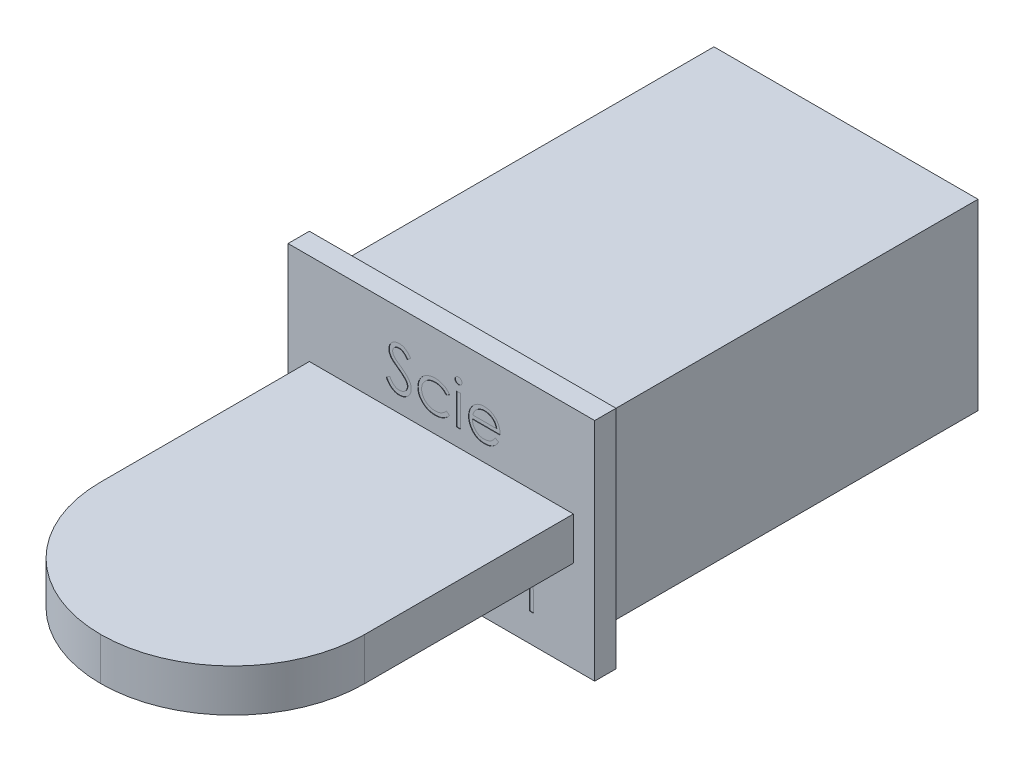
from build123d import *

# Parameters (mm, degrees)
ESQUISSE1_W             = 720
ESQUISSE1_H             = 530
BOSS_EXTRU_1_DEPTH      = 50
ESQUISSE2_W             = 620
ESQUISSE2_H             = 430
BOSS_EXTRU_2_DEPTH      = 900
ESQUISSE3_W             = 620
ESQUISSE3_H             = 100
BOSS_EXTRU_3_DEPTH      = 800
CONG_1_R                = 310
ESQUISSE4_W             = 8.974358974
ESQUISSE4_H             = 73.076923077
ENL_V_MAT_EXTRU_1_DEPTH = 1


with BuildPart() as part:
    # Esquisse1 → Boss.-Extru.1 (new body)
    with BuildSketch(Plane.XY):
        with Locations((360, 265)):
            Rectangle(ESQUISSE1_W, ESQUISSE1_H)
    extrude(amount=BOSS_EXTRU_1_DEPTH)

    # Esquisse2 → Boss.-Extru.2 (add)
    with BuildSketch(Plane(origin=(0, 0, 0), x_dir=(-1, 0, 0), z_dir=(0, 0, -1))):
        with Locations((-360, 265)):
            Rectangle(ESQUISSE2_W, ESQUISSE2_H)
    extrude(amount=BOSS_EXTRU_2_DEPTH)

    # Esquisse3 → Boss.-Extru.3 (add)
    with BuildSketch(Plane.XY.offset(50)):
        with Locations((360, 265)):
            Rectangle(ESQUISSE3_W, ESQUISSE3_H)
    extrude(amount=BOSS_EXTRU_3_DEPTH)

    # Congé1
    cong_1_edges = [part.edges().sort_by_distance(p)[0] for p in [
        (670, 265, 850),
        (50, 265, 850),
    ]]
    fillet(cong_1_edges, radius=CONG_1_R - 0.0001)  # a hair under: the kernel refuses the full size

    # Esquisse4 → Enlèv. mat.-Extru.1 (cut)
    # profile 1 of 10: a face of its own
    with BuildSketch(Plane.XY.offset(50)):
        with BuildLine():
            Line((230.237927388, 373.871225546), (238.691453029, 378.93933452))
            add(Edge.make_bspline(
                [(238.691453029, 378.93933452), (239.477688379, 377.623209236), (240.984084969, 375.101563981), (243.496980945, 371.694191398), (246.100778406, 368.798129776), (248.814759365, 366.430226703), (251.622357883, 364.565972796), (254.541902275, 363.245909033), (257.56355401, 362.422595451), (259.619948909, 362.322592978), (260.646581234, 362.272667853)],
                knots=[0, 0, 0, 0, 1.272034388, 2.437168799, 3.508375237, 4.49857839, 5.41946034, 6.295179144, 7.148887113, 8, 8, 8, 8], degree=3))
            add(Edge.make_bspline(
                [(260.646581234, 362.272667853), (261.523348678, 362.297087068), (263.261542193, 362.345498218), (265.820463421, 362.810663991), (268.305657771, 363.525296246), (270.665904563, 364.548751432), (272.868636407, 365.786993881), (274.800256274, 367.282598953), (276.470145222, 368.957061973), (277.836119924, 370.82513782), (278.884120932, 372.834199209), (279.689608601, 374.896369247), (280.136610706, 377.044042627), (280.203946519, 378.490055851), (280.237927388, 379.219783238)],
                knots=[0, 0, 0, 0, 1.095163259, 2.171163733, 3.241058638, 4.321873601, 5.38011039, 6.391990106, 7.366004449, 8.327778327, 9.272591725, 10.192022065, 11.087607919, 12, 12, 12, 12], degree=3))
            add(Edge.make_bspline(
                [(280.237927388, 379.219783238), (280.195804225, 380.052378944), (280.110173991, 381.744924348), (279.386417417, 384.24205729), (278.247867507, 386.713273576), (277.197506259, 388.241881164), (276.652190209, 389.035488366)],
                knots=[0, 0, 0, 0, 0.938893495, 1.908633276, 2.914225137, 4, 4, 4, 4], degree=3))
            add(Edge.make_bspline(
                [(276.652190209, 389.035488366), (276.204458375, 389.608254755), (275.264501395, 390.810706143), (273.648572464, 392.600570013), (271.75239777, 394.446810555), (269.640867629, 396.419926468), (267.237065091, 398.42814923), (264.616278965, 400.567242886), (261.711597281, 402.755859373), (259.674468806, 404.22364696), (258.623344055, 404.981001187)],
                knots=[0, 0, 0, 0, 0.722233717, 1.516239348, 2.393582979, 3.351407094, 4.387010283, 5.505090956, 6.712668013, 8, 8, 8, 8], degree=3))
            add(Edge.make_bspline(
                [(258.623344055, 404.981001187), (257.571229878, 405.730389404), (255.55966769, 407.163162611), (252.746565338, 409.289570726), (250.231009252, 411.233681284), (248.024180208, 413.013795916), (246.12704887, 414.630156051), (244.524665698, 416.067240027), (243.257849781, 417.363913194), (242.553404619, 418.205094387), (242.237126106, 418.582764007)],
                knots=[0, 0, 0, 0, 1.452282411, 2.77665338, 3.964542531, 5.026858415, 5.96415736, 6.766646006, 7.446254459, 8, 8, 8, 8], degree=3))
            add(Edge.make_bspline(
                [(242.237126106, 418.582764007), (241.795053385, 419.17136506), (240.925658051, 420.328928025), (239.778057894, 422.138209676), (238.802653243, 423.990302973), (238.038015182, 425.890184818), (237.394123215, 427.811182786), (236.96103948, 429.778361234), (236.689856711, 431.78289319), (236.662085668, 433.131850351), (236.648183799, 433.807122982)],
                knots=[0, 0, 0, 0, 1.068054152, 2.10047183, 3.106115577, 4.101338837, 5.06977816, 6.043150881, 7.020423561, 8, 8, 8, 8], degree=3))
            add(Edge.make_bspline(
                [(236.648183799, 433.807122982), (236.685475484, 434.865116541), (236.759261772, 436.95848979), (237.383276551, 440.016513517), (238.368216369, 442.936125438), (239.748070308, 445.688420687), (241.52685182, 448.201734427), (243.585308231, 450.504976912), (246.03706498, 452.441222118), (248.727139931, 454.132995215), (251.671607705, 455.457164507), (254.757062087, 456.456049654), (257.988407002, 457.022028445), (260.177067992, 457.1032503), (261.287606875, 457.144462725)],
                knots=[0, 0, 0, 0, 1.005424448, 1.989358655, 2.955360095, 3.929531133, 4.905563448, 5.876582895, 6.856512386, 7.866279853, 8.892233794, 9.918561126, 10.94386622, 12, 12, 12, 12], degree=3))
            add(Edge.make_bspline(
                [(261.287606875, 457.144462725), (262.466009741, 457.103818394), (264.809476934, 457.022989791), (268.256597379, 456.320203182), (271.57547499, 455.157326845), (274.245282556, 453.837650903), (276.334790027, 452.519610454), (277.928296675, 451.319044046), (279.543080983, 449.936898086), (281.192168264, 448.369491055), (282.847615677, 446.602441024), (284.534000026, 444.647849912), (286.25526485, 442.517662602), (287.362575139, 440.99696258), (287.930235081, 440.217379392)],
                knots=[0, 0, 0, 0, 1.286793592, 2.559021753, 3.825965368, 5.121522368, 5.803751409, 6.523245864, 7.299691795, 8.125521123, 9.008227632, 9.944561021, 10.946284179, 12, 12, 12, 12], degree=3))
            Line((287.930235081, 440.217379392), (279.817254311, 434.067539648))
            add(Edge.make_bspline(
                [(279.817254311, 434.067539648), (279.327370526, 434.698645089), (278.383968896, 435.91400661), (276.951697843, 437.616044198), (275.601736474, 439.170800756), (274.271725051, 440.521232986), (273.031907009, 441.741293938), (271.828562945, 442.785858419), (270.679010053, 443.665161146), (269.229955463, 444.603548573), (267.409449225, 445.533734389), (265.124176761, 446.320850905), (262.735997474, 446.793852675), (261.109436574, 446.856392319), (260.286004311, 446.888052469)],
                knots=[0, 0, 0, 0, 1.181633172, 2.275549214, 3.290209073, 4.226197932, 5.078386478, 5.862611352, 6.581680152, 7.217281963, 8.414376989, 9.595101626, 10.782541182, 12, 12, 12, 12], degree=3))
            add(Edge.make_bspline(
                [(260.286004311, 446.888052469), (259.252960814, 446.85343247), (257.260833745, 446.786671064), (254.432541285, 446.057528627), (251.887000569, 444.909475476), (249.699784424, 443.300476102), (247.878727937, 441.394162025), (246.561429116, 439.200480451), (245.768567271, 436.778126091), (245.671816424, 435.088364482), (245.622542773, 434.227796059)],
                knots=[0, 0, 0, 0, 1.14458467, 2.207223713, 3.21896685, 4.227309161, 5.202851033, 6.127160689, 7.046193047, 8, 8, 8, 8], degree=3))
            add(Edge.make_bspline(
                [(245.622542773, 434.227796059), (245.633774962, 433.692039529), (245.656257708, 432.619650402), (245.969823357, 431.035324061), (246.372661327, 429.455000077), (247.011022234, 427.885783425), (247.892316623, 426.300230309), (249.049607363, 424.671037807), (250.507130565, 422.983846131), (251.623616632, 421.886492595), (252.213087645, 421.307122982)],
                knots=[0, 0, 0, 0, 0.858281714, 1.717966888, 2.583508476, 3.4729293, 4.427298488, 5.488583878, 6.674047936, 8, 8, 8, 8], degree=3))
            add(Edge.make_bspline(
                [(252.213087645, 421.307122982), (252.431983999, 421.111779387), (252.952031632, 420.64768772), (253.902772367, 419.887908273), (255.158280888, 418.950686208), (256.68577235, 417.791048594), (258.513411257, 416.445863962), (260.641398575, 414.932332186), (263.046013799, 413.201319072), (264.752354253, 411.991103626), (265.654594055, 411.351193494)],
                knots=[0, 0, 0, 0, 0.420754252, 0.999615792, 1.744751191, 2.668019286, 3.750313428, 4.999500688, 6.413464383, 8, 8, 8, 8], degree=3))
            add(Edge.make_bspline(
                [(265.654594055, 411.351193494), (266.739905864, 410.561440364), (268.84146176, 409.032192886), (271.831678329, 406.734602028), (274.542929989, 404.487522926), (276.984735805, 402.30530558), (279.181218904, 400.204502923), (281.108010923, 398.159840628), (282.784744647, 396.185967123), (284.589865175, 393.655322103), (286.434374304, 390.547291124), (288.018417373, 386.739341451), (289.0172273, 382.916589437), (289.147842027, 380.347251252), (289.212286363, 379.079558879)],
                knots=[0, 0, 0, 0, 1.163667725, 2.253281268, 3.268753668, 4.215851969, 5.092017293, 5.902905408, 6.650798638, 7.335211899, 8.59617414, 9.77448103, 10.901945474, 12, 12, 12, 12], degree=3))
            add(Edge.make_bspline(
                [(289.212286363, 379.079558879), (289.193510988, 378.183034162), (289.156324843, 376.407394632), (288.728870163, 373.800106721), (288.102594016, 371.267796159), (287.158673046, 368.841764375), (286.00658281, 366.477628298), (284.544690014, 364.237402572), (282.850184736, 362.07150547), (280.906362881, 360.037691431), (278.779337101, 358.17065726), (276.531231539, 356.509826932), (274.158366598, 355.125017692), (271.673614693, 353.994993634), (269.076405072, 353.111178847), (266.367611249, 352.470811158), (263.542768071, 352.077790846), (261.622754312, 352.036997661), (260.646581234, 352.016257597)],
                knots=[0, 0, 0, 0, 0.983748083, 1.948392443, 2.894712957, 3.844097841, 4.80183111, 5.778335162, 6.776009319, 7.81870978, 8.863265674, 9.881300176, 10.883814829, 11.87499822, 12.874611388, 13.892143829, 14.928324115, 16, 16, 16, 16], degree=3))
            add(Edge.make_bspline(
                [(260.646581234, 352.016257597), (259.891285721, 352.030862786), (258.390206862, 352.059889225), (256.169935951, 352.316497237), (253.994519117, 352.67955734), (251.891253916, 353.255959339), (249.833042155, 353.95530154), (247.828835454, 354.816396758), (245.877662487, 355.848316799), (243.968588691, 357.028174645), (242.106469417, 358.401253062), (240.308770333, 360.000495817), (238.51650789, 361.78179596), (236.782582281, 363.793526341), (235.071921015, 366.003185851), (233.418252171, 368.431448234), (231.787345951, 371.065086913), (230.764046871, 372.918375077), (230.237927388, 373.871225546)],
                knots=[0, 0, 0, 0, 0.915332311, 1.819136955, 2.706846663, 3.586547465, 4.459518054, 5.340707479, 6.227863349, 7.133153174, 8.059268498, 9.028702269, 10.047606654, 11.120612155, 12.245963614, 13.433783089, 14.680604001, 16, 16, 16, 16], degree=3))
        make_face()
    # profile 2 of 10: a face of its own
    with BuildSketch(Plane.XY.offset(50)):
        with BuildLine():
            Line((378.955876106, 411.811930674), (371.443856875, 407.144462725))
            add(Edge.make_bspline(
                [(371.443856875, 407.144462725), (370.620146436, 408.168131121), (368.998812286, 410.183048558), (366.183405534, 412.783332366), (363.183079413, 415.016676416), (359.946563764, 416.836783586), (356.478398048, 418.24311074), (352.792259441, 419.238259468), (348.888673587, 419.858380692), (346.212525043, 419.928861745), (344.841292773, 419.964975546)],
                knots=[0, 0, 0, 0, 1.026593902, 2.0206758, 2.988051866, 3.946915611, 4.916868779, 5.907761954, 6.927957743, 8, 8, 8, 8], degree=3))
            add(Edge.make_bspline(
                [(344.841292773, 419.964975546), (343.745322575, 419.934780054), (341.586839072, 419.875310854), (338.41809183, 419.503582473), (335.399738884, 418.828096521), (332.512861486, 417.938069187), (329.777992385, 416.74520376), (327.187966144, 415.293496442), (324.719809287, 413.606352434), (322.445045249, 411.651765422), (320.364216475, 409.526089204), (318.561390359, 407.247412193), (316.991763697, 404.88398673), (315.760164944, 402.376794095), (314.752302931, 399.783192574), (314.089253782, 397.054225269), (313.647405342, 394.224853624), (313.596853096, 392.295758203), (313.571260722, 391.319142212)],
                knots=[0, 0, 0, 0, 1.112346261, 2.190735716, 3.231507886, 4.247384806, 5.251966152, 6.253067467, 7.256802811, 8.280671706, 9.291813951, 10.270744147, 11.225547591, 12.165006084, 13.100104208, 14.043489273, 15.009504848, 16, 16, 16, 16], degree=3))
            add(Edge.make_bspline(
                [(313.571260722, 391.319142212), (313.622096499, 390.040021897), (313.723083086, 387.499016303), (314.514553363, 383.748213395), (315.810107858, 380.121822242), (317.583189305, 376.645589753), (319.825393146, 373.428613888), (322.458894954, 370.543372334), (325.485154476, 368.045771528), (328.877506783, 365.975127954), (332.556299453, 364.310517451), (336.481731017, 363.124593654), (340.621724744, 362.408811581), (343.456203233, 362.31864178), (344.901388927, 362.272667853)],
                knots=[0, 0, 0, 0, 0.966302908, 1.919585723, 2.883856336, 3.870342332, 4.860282998, 5.839159637, 6.814385684, 7.815993281, 8.834850808, 9.858348828, 10.908058873, 12, 12, 12, 12], degree=3))
            add(Edge.make_bspline(
                [(344.901388927, 362.272667853), (346.225822766, 362.309796345), (348.828686721, 362.382763683), (352.633466294, 362.997876921), (356.255749461, 364.004837881), (359.695407478, 365.409056454), (362.946155079, 367.224128337), (365.986988649, 369.462961789), (368.878415457, 372.061150369), (370.578329073, 374.070235263), (371.443856875, 375.093180674)],
                knots=[0, 0, 0, 0, 1.039848629, 2.043578496, 3.018386758, 3.987534228, 4.954977003, 5.934852016, 6.948509513, 8, 8, 8, 8], degree=3))
            Line((371.443856875, 375.093180674), (378.955876106, 370.165296059))
            add(Edge.make_bspline(
                [(378.955876106, 370.165296059), (378.510513186, 369.51127529), (377.62126556, 368.205404529), (376.134761976, 366.364144053), (374.531338213, 364.640667415), (372.817249731, 363.03728484), (371.014878021, 361.515627148), (369.062652033, 360.148439305), (367.023520277, 358.858872942), (364.873544342, 357.698505165), (362.63495297, 356.655467406), (360.310896124, 355.758576814), (357.911472903, 354.98800236), (355.433862155, 354.375506738), (352.873179347, 353.886625638), (350.236046934, 353.562234165), (347.523373174, 353.320083276), (345.689883137, 353.305629936), (344.761164568, 353.298308879)],
                knots=[0, 0, 0, 0, 0.954134338, 1.905101784, 2.851144739, 3.791306361, 4.734911809, 5.6936923, 6.663572882, 7.643865596, 8.638447847, 9.640600242, 10.646758161, 11.676244097, 12.717260333, 13.78922464, 14.880174919, 16, 16, 16, 16], degree=3))
            add(Edge.make_bspline(
                [(344.761164568, 353.298308879), (343.343710748, 353.323774016), (340.565490974, 353.37368587), (336.499133614, 353.922499453), (332.613028836, 354.749859918), (328.908504323, 355.937395172), (325.384983344, 357.466103037), (322.045751395, 359.333443454), (318.90186516, 361.554923165), (315.984414224, 364.09100229), (313.304944334, 366.840734889), (311.004196038, 369.807875402), (309.008616878, 372.883333911), (307.406115647, 376.135034656), (306.130489178, 379.519759586), (305.258922533, 383.064623584), (304.695215741, 386.740402271), (304.629976326, 389.247056044), (304.596901747, 390.517860161)],
                knots=[0, 0, 0, 0, 1.1129367, 2.181364009, 3.217532258, 4.231199276, 5.232079859, 6.230262199, 7.231623845, 8.250719726, 9.263571943, 10.242672461, 11.195837495, 12.138959767, 13.085126421, 14.0317438, 15.002148558, 16, 16, 16, 16], degree=3))
            add(Edge.make_bspline(
                [(304.596901747, 390.517860161), (304.609502208, 391.380101148), (304.634566605, 393.095240786), (304.922050255, 395.64081412), (305.293435196, 398.152486844), (305.922741969, 400.598421682), (306.64961716, 403.015715684), (307.577489497, 405.375232865), (308.665929351, 407.687937803), (309.901699274, 409.947872934), (311.292806277, 412.117859776), (312.832270084, 414.167964481), (314.462108262, 416.122814924), (316.258568606, 417.914922371), (318.145415859, 419.615956408), (320.176032307, 421.180474246), (322.338770926, 422.613073988), (324.601151571, 423.940245858), (326.961857609, 425.121944003), (329.406619619, 426.140036513), (331.920706169, 427.01011011), (334.50813886, 427.698936374), (337.151743807, 428.276577041), (339.872353463, 428.639944079), (342.659559813, 428.896694733), (344.546874747, 428.925003081), (345.502350465, 428.93933452)],
                knots=[0, 0, 0, 0, 0.990994727, 1.971252077, 2.943264845, 3.907940874, 4.872158414, 5.844625996, 6.82015047, 7.809835459, 8.804511986, 9.781214284, 10.756496977, 11.728388426, 12.696359165, 13.676225489, 14.672885716, 15.677705647, 16.690706858, 17.706033469, 18.721040654, 19.747369689, 20.783475414, 21.830280724, 22.901553713, 24, 24, 24, 24], degree=3))
            add(Edge.make_bspline(
                [(345.502350465, 428.93933452), (346.698924981, 428.912994775), (349.086092971, 428.860446944), (352.627256018, 428.418199738), (356.116261557, 427.751444984), (359.491893086, 426.763649847), (362.71322207, 425.567545398), (365.728520647, 424.224324987), (368.466809329, 422.664479175), (370.979026161, 420.958190193), (373.269869514, 419.033592886), (375.362855016, 416.867679817), (377.300902136, 414.471723273), (378.399665321, 412.705845236), (378.955876106, 411.811930674)],
                knots=[0, 0, 0, 0, 1.095225653, 2.184976855, 3.262915854, 4.344593502, 5.400796181, 6.407717688, 7.363229445, 8.282371371, 9.184954523, 10.097238608, 11.036792983, 12, 12, 12, 12], degree=3))
        make_face()
    # profile 3 of 10: a face of its own
    with BuildSketch(Plane.XY.offset(50)):
        with BuildLine():
            add(Edge.make_bspline(
                [(400.069658158, 458.426514007), (400.626552894, 458.400681082), (401.717059747, 458.350095252), (403.294010252, 457.916910193), (404.729924883, 457.182633466), (406.003574394, 456.197499725), (407.096485442, 455.038944198), (407.861648595, 453.688630818), (408.353431342, 452.229812567), (408.412818635, 451.212238591), (408.443055593, 450.694142212)],
                knots=[0, 0, 0, 0, 1.055194115, 2.066272739, 3.074728998, 4.095836921, 5.109056067, 6.073838105, 7.019297344, 8, 8, 8, 8], degree=3))
            add(Edge.make_bspline(
                [(408.443055593, 450.694142212), (408.412136741, 450.189494979), (408.35101383, 449.191867122), (407.862028451, 447.758339349), (407.089964513, 446.426788392), (406.004275209, 445.270482386), (404.729739181, 444.285893243), (403.294059585, 443.551472132), (401.71704677, 443.11832535), (400.626548508, 443.067734243), (400.069658158, 443.041898623)],
                knots=[0, 0, 0, 0, 0.96129708, 1.900370562, 2.859976407, 3.87933698, 4.906634145, 5.921202961, 6.938410037, 8, 8, 8, 8], degree=3))
            add(Edge.make_bspline(
                [(400.069658158, 443.041898623), (399.51913601, 443.066747772), (398.447616577, 443.115113394), (396.894278224, 443.559971044), (395.470607099, 444.286144561), (394.194473594, 445.264035564), (393.13075379, 446.43388977), (392.356515922, 447.757526738), (391.868659868, 449.192074012), (391.807384765, 450.189564478), (391.776388927, 450.694142212)],
                knots=[0, 0, 0, 0, 1.054934014, 2.053291228, 3.073705704, 4.106921865, 5.123545215, 6.088680038, 7.033164197, 8, 8, 8, 8], degree=3))
            add(Edge.make_bspline(
                [(391.776388927, 450.694142212), (391.806705687, 451.212166487), (391.866249718, 452.229598847), (392.356881607, 453.68945693), (393.124304686, 455.031785553), (394.19517793, 456.20394268), (395.470419652, 457.182383673), (396.894326657, 457.908411716), (398.447603782, 458.353307127), (399.519131667, 458.401667536), (400.069658158, 458.426514007)],
                knots=[0, 0, 0, 0, 0.98631895, 1.937192651, 2.907499808, 3.917963147, 4.944918757, 5.95915025, 6.951458133, 8, 8, 8, 8], degree=3))
        make_face()
    # profile 4 of 10: a face of its own
    with BuildSketch(Plane.XY.offset(50)):
        with Locations((400.10972226, 391.1188217)):
            Rectangle(ESQUISSE4_W, ESQUISSE4_H)
    # profile 5 of 10: a face of its own
    with BuildSketch(Plane.XY.offset(50)):
        with BuildLine():
            Line((486.367735081, 377.657283238), (494.340491491, 373.47058452))
            add(Edge.make_bspline(
                [(494.340491491, 373.47058452), (493.705160198, 372.343632198), (492.469057099, 370.15102926), (490.343321445, 367.13869039), (488.114976514, 364.428755651), (485.683434571, 362.093622672), (483.121443744, 360.057868815), (480.414796464, 358.276788109), (477.549401672, 356.759116099), (474.525123821, 355.480472446), (471.316565217, 354.497344043), (467.915950462, 353.802937731), (464.31676488, 353.373701484), (461.849731169, 353.323840319), (460.586485081, 353.298308879)],
                knots=[0, 0, 0, 0, 1.120438281, 2.179929193, 3.190490725, 4.156257408, 5.095198341, 6.022838206, 6.959905092, 7.901321166, 8.864066838, 9.862729781, 10.905609505, 12, 12, 12, 12], degree=3))
            add(Edge.make_bspline(
                [(460.586485081, 353.298308879), (459.18242858, 353.331085317), (456.443521104, 353.395022652), (452.456671186, 353.946235922), (448.702973518, 354.84544617), (445.182639136, 356.101604498), (441.904289062, 357.742385187), (438.861407496, 359.741227524), (436.037992472, 362.087863372), (433.523015066, 364.8026189), (431.258904132, 367.70781768), (429.261023561, 370.735128666), (427.590811245, 373.876935079), (426.23216524, 377.113235766), (425.134883383, 380.423632725), (424.370120419, 383.838246084), (423.929270476, 387.347834205), (423.861714889, 389.722043797), (423.827670978, 390.918501187)],
                knots=[0, 0, 0, 0, 1.145258523, 2.234067595, 3.276747158, 4.290159414, 5.277019952, 6.260822364, 7.254936242, 8.264827045, 9.274100331, 10.257902744, 11.220704747, 12.172965371, 13.118907548, 14.062713208, 15.023725156, 16, 16, 16, 16], degree=3))
            add(Edge.make_bspline(
                [(423.827670978, 390.918501187), (423.857932159, 392.041210627), (423.917905823, 394.266272475), (424.29592832, 397.559573748), (424.965879551, 400.760386677), (425.885203092, 403.871370905), (427.072381554, 406.88731759), (428.524730675, 409.810062265), (430.244512897, 412.636494832), (431.572303576, 414.41944151), (432.241132517, 415.317539648)],
                knots=[0, 0, 0, 0, 1.024358464, 2.0301432, 3.019427413, 4.004406732, 4.986367066, 5.972626655, 6.978780325, 8, 8, 8, 8], degree=3))
            add(Edge.make_bspline(
                [(432.241132517, 415.317539648), (433.14706631, 416.399507365), (434.930236213, 418.529168807), (437.94613208, 421.327406686), (441.211851976, 423.671514548), (444.686469865, 425.614575581), (448.410369123, 427.090965495), (452.333491724, 428.19118213), (456.500508474, 428.807696731), (459.349229069, 428.894777692), (460.806837645, 428.93933452)],
                knots=[0, 0, 0, 0, 1.030682036, 2.02871468, 2.997146059, 3.962720338, 4.930598197, 5.918074684, 6.934738563, 8, 8, 8, 8], degree=3))
            add(Edge.make_bspline(
                [(460.806837645, 428.93933452), (462.305340653, 428.900647409), (465.245061966, 428.824752116), (469.531693996, 428.12114259), (473.587714468, 427.005355316), (477.411500306, 425.429532731), (481.003439184, 423.39640268), (484.340183458, 420.878064351), (487.478798102, 417.951833288), (489.304757498, 415.701455876), (490.233920978, 414.5563217)],
                knots=[0, 0, 0, 0, 1.056321875, 2.072262726, 3.055038591, 4.01806755, 4.982017516, 5.957941055, 6.960871419, 8, 8, 8, 8], degree=3))
            add(Edge.make_bspline(
                [(490.233920978, 414.5563217), (490.866119216, 413.693362231), (492.12630759, 411.973187412), (493.704796162, 409.168297209), (495.075007447, 406.233708799), (496.170234905, 403.121986025), (497.057077796, 399.86999802), (497.698701189, 396.454496742), (498.074976006, 392.876499275), (498.148938787, 390.43859769), (498.186645337, 389.195744777)],
                knots=[0, 0, 0, 0, 0.94817472, 1.890038105, 2.849395472, 3.817997239, 4.812318967, 5.836947057, 6.897266129, 8, 8, 8, 8], degree=3))
            Line((498.186645337, 389.195744777), (432.802029952, 389.195744777))
            add(Edge.make_bspline(
                [(432.802029952, 389.195744777), (432.846018708, 388.232874369), (432.93252082, 386.339428548), (433.335810625, 383.568834746), (433.971489876, 380.929596398), (434.864891665, 378.441509485), (435.94680153, 376.07207727), (437.272107724, 373.838876214), (438.853237837, 371.752078212), (440.616829248, 369.793017138), (442.579889114, 368.048423962), (444.645110464, 366.486944641), (446.842069463, 365.178213306), (449.153443277, 364.115930741), (451.575494281, 363.284321711), (454.108985571, 362.716669692), (456.748931752, 362.336466638), (458.548524153, 362.29419049), (459.464690209, 362.272667853)],
                knots=[0, 0, 0, 0, 1.094153842, 2.151609401, 3.174256925, 4.172055639, 5.149267565, 6.128595816, 7.11444997, 8.118368179, 9.117203808, 10.09244225, 11.054858984, 12.015122123, 12.976791628, 13.957293641, 14.960065497, 16, 16, 16, 16], degree=3))
            add(Edge.make_bspline(
                [(459.464690209, 362.272667853), (460.360437283, 362.290040901), (462.13777131, 362.32451236), (464.784652948, 362.659709814), (467.388639445, 363.201717689), (469.938953253, 363.941431692), (472.383834565, 364.843627466), (474.647993138, 365.932280542), (476.730285013, 367.13655902), (478.676484058, 368.513978307), (480.564226725, 370.199926507), (482.436869194, 372.30380425), (484.444773576, 374.792019329), (485.701619083, 376.664752643), (486.367735081, 377.657283238)],
                knots=[0, 0, 0, 0, 0.99110716, 1.966546729, 2.947904876, 3.932708344, 4.903319531, 5.828989031, 6.710028674, 7.56322171, 8.463672341, 9.504779593, 10.677557249, 12, 12, 12, 12], degree=3))
        make_face()
        with BuildLine():
            add(Edge.make_bspline(
                [(489.212286363, 398.170103751), (488.883811375, 399.360471572), (488.251602762, 401.651546445), (486.930563777, 404.824143315), (485.442805472, 407.64379763), (483.682184575, 410.088930003), (481.687363843, 412.260458945), (479.383215768, 414.158132807), (476.799333096, 415.855774266), (473.949071934, 417.288702822), (470.930735218, 418.508413071), (467.770558304, 419.326273521), (464.546050079, 419.886546159), (462.365070469, 419.938720685), (461.267574824, 419.964975546)],
                knots=[0, 0, 0, 0, 1.154881502, 2.222775134, 3.210006277, 4.132804581, 5.035138423, 5.962687519, 6.919655026, 7.923214229, 8.944639381, 9.960483929, 10.97369054, 12, 12, 12, 12], degree=3))
            add(Edge.make_bspline(
                [(461.267574824, 419.964975546), (460.371876581, 419.947499216), (458.601269465, 419.912952186), (455.992667517, 419.585234205), (453.487533262, 419.043524352), (451.067382187, 418.301668449), (448.763928805, 417.312851234), (446.52979257, 416.153330474), (444.421781249, 414.737856651), (443.103458521, 413.659032227), (442.437446619, 413.114014007)],
                knots=[0, 0, 0, 0, 1.04873581, 2.073130211, 3.073294108, 4.04793562, 5.032784715, 6.005352987, 6.992311501, 8, 8, 8, 8], degree=3))
            add(Edge.make_bspline(
                [(442.437446619, 413.114014007), (441.960495706, 412.682747847), (440.995263299, 411.809970245), (439.705534114, 410.306278629), (438.470663466, 408.684805425), (437.346844816, 406.88351615), (436.316056631, 404.922922465), (435.351485854, 402.819561458), (434.483302652, 400.557472022), (433.994842365, 398.981116615), (433.743536363, 398.170103751)],
                knots=[0, 0, 0, 0, 0.879870761, 1.780643979, 2.707998968, 3.669668524, 4.684282772, 5.740141944, 6.837334558, 8, 8, 8, 8], degree=3))
            Line((433.743536363, 398.170103751), (489.212286363, 398.170103751))
        make_face(mode=Mode.SUBTRACT)
    # profile 6 of 10: a face of its own
    with BuildSketch(Plane.XY.offset(50)):
        with BuildLine():
            Line((155.746113094, 166.139034497), (175.758132325, 166.139034497))
            add(Edge.make_bspline(
                [(175.758132325, 166.139034497), (177.093593139, 166.134589183), (179.657825837, 166.126053688), (183.331347847, 166.078460462), (186.669264904, 165.942050299), (189.669831742, 165.8246622), (192.332993313, 165.610606733), (194.666915905, 165.406016815), (196.66085012, 165.138197936), (197.867874443, 164.889471566), (198.414382325, 164.77685501)],
                knots=[0, 0, 0, 0, 1.410062039, 2.707475311, 3.878576406, 4.937260626, 5.877586885, 6.699081471, 7.410979367, 8, 8, 8, 8], degree=3))
            add(Edge.make_bspline(
                [(198.414382325, 164.77685501), (199.146000157, 164.596090285), (200.593628428, 164.238417038), (202.677916029, 163.482428443), (204.66403957, 162.607582025), (206.543748837, 161.580047159), (208.307628585, 160.392196311), (209.973866036, 159.06453567), (211.550022133, 157.604329791), (212.972354424, 155.974762891), (214.313470186, 154.265148329), (215.444573801, 152.416469562), (216.419616079, 150.483283061), (217.195916564, 148.445928268), (217.821001521, 146.324163358), (218.261751217, 144.098769165), (218.526070864, 141.779884163), (218.552981022, 140.198229626), (218.566625914, 139.396246036)],
                knots=[0, 0, 0, 0, 1.027469482, 2.033020251, 3.019912614, 3.986113645, 4.951240523, 5.91722682, 6.890402269, 7.87763091, 8.8651537, 9.85103654, 10.82876324, 11.815024772, 12.821070561, 13.842952187, 14.906261191, 16, 16, 16, 16], degree=3))
            add(Edge.make_bspline(
                [(218.566625914, 139.396246036), (218.52465454, 138.063814475), (218.442757517, 135.463895393), (217.679183126, 131.690727352), (216.42842542, 128.171032648), (214.704902877, 124.909242994), (212.510060714, 121.968938841), (209.872209539, 119.386354403), (206.789877782, 117.225214044), (203.920468756, 115.726562481), (201.385777336, 114.766765091), (199.299111256, 114.091440553), (197.022911899, 113.569670116), (194.578988053, 113.10223778), (191.957169325, 112.749332225), (189.163739628, 112.490858097), (186.196706724, 112.329313849), (184.1584476, 112.305256566), (183.109895145, 112.292880651)],
                knots=[0, 0, 0, 0, 1.260483769, 2.459530307, 3.627416485, 4.787058657, 5.939039949, 7.08810263, 8.267026773, 9.491475466, 10.141966685, 10.831826277, 11.566392101, 12.351337768, 13.187381173, 14.07005841, 15.007169909, 16, 16, 16, 16], degree=3))
            Line((183.109895145, 112.292880651), (219.848677196, 66.139034497))
            Line((219.848677196, 66.139034497), (208.750920786, 66.139034497))
            Line((208.750920786, 66.139034497), (172.012138735, 112.292880651))
            Line((172.012138735, 112.292880651), (164.720472068, 112.292880651))
            Line((164.720472068, 112.292880651), (164.720472068, 66.139034497))
            Line((164.720472068, 66.139034497), (155.746113094, 66.139034497))
            Line((155.746113094, 66.139034497), (155.746113094, 166.139034497))
        make_face()
        with BuildLine():
            Line((164.720472068, 155.882624241), (164.720472068, 122.549290907))
            Line((164.720472068, 122.549290907), (183.02976694, 122.409066548))
            add(Edge.make_bspline(
                [(183.02976694, 122.409066548), (183.884625195, 122.408688358), (185.54158397, 122.407955318), (187.938745822, 122.522063211), (190.170749013, 122.651872303), (192.229056217, 122.850425033), (194.114586941, 123.106312797), (195.826398747, 123.426398061), (197.367285944, 123.799314136), (199.164387042, 124.376503445), (201.171145081, 125.29096111), (203.352043935, 126.62140393), (205.209253585, 128.294807334), (206.778335365, 130.20833465), (208.039176264, 132.312227474), (208.928092102, 134.581266594), (209.492161882, 136.958169394), (209.558691752, 138.591829618), (209.59226694, 139.416278087)],
                knots=[0, 0, 0, 0, 1.146690395, 2.22261258, 3.21895312, 4.145990853, 4.996080663, 5.770904154, 6.481378293, 7.121626537, 8.300444488, 9.431385265, 10.535395872, 11.636531494, 12.74115979, 13.810798291, 14.895190096, 16, 16, 16, 16], degree=3))
            add(Edge.make_bspline(
                [(209.59226694, 139.416278087), (209.557920623, 140.220465908), (209.489858756, 141.814072727), (208.934179655, 144.147098735), (207.994483045, 146.349011596), (206.72813339, 148.410854024), (205.185300391, 150.282446477), (203.376220028, 151.883793708), (201.35035731, 153.205206984), (199.4568945, 154.049617856), (197.764488429, 154.567327949), (196.29506957, 154.931646915), (194.634741635, 155.224346027), (192.775442818, 155.458862052), (190.72511051, 155.660431888), (188.473377622, 155.796196992), (186.0351839, 155.87659311), (184.34527158, 155.880567078), (183.470472068, 155.882624241)],
                knots=[0, 0, 0, 0, 1.101028733, 2.181837193, 3.264309656, 4.369019818, 5.486613113, 6.575447106, 7.666700264, 8.788928104, 9.402425223, 10.0903467, 10.862060571, 11.710948788, 12.657782767, 13.684531032, 14.801375019, 16, 16, 16, 16], degree=3))
            Line((183.470472068, 155.882624241), (164.720472068, 155.882624241))
        make_face(mode=Mode.SUBTRACT)
    # profile 7 of 10: a face of its own
    with BuildSketch(Plane.XY.offset(50)):
        with BuildLine():
            Line((236.515343863, 139.215957574), (245.489702838, 139.215957574))
            Line((245.489702838, 139.215957574), (245.489702838, 105.321726805))
            add(Edge.make_bspline(
                [(245.489702838, 105.321726805), (245.493757263, 104.326791114), (245.50151319, 102.423525741), (245.554111502, 99.68480612), (245.677828463, 97.187185758), (245.832509163, 94.929221851), (246.031427338, 92.911296377), (246.268094781, 91.140457605), (246.532621113, 89.596623774), (246.791555798, 88.666813611), (246.911978479, 88.234387061)],
                knots=[0, 0, 0, 0, 1.388932606, 2.656963016, 3.823490214, 4.879454478, 5.816252168, 6.653371382, 7.373723809, 8, 8, 8, 8], degree=3))
            add(Edge.make_bspline(
                [(246.911978479, 88.234387061), (247.105162907, 87.690876462), (247.487515508, 86.615154716), (248.181043615, 85.06118314), (249.038996089, 83.621889356), (249.977848314, 82.241772993), (251.060688531, 80.961716224), (252.273816277, 79.783880692), (253.576623049, 78.663763799), (255.51248086, 77.338484028), (258.159888459, 75.918046024), (261.635681469, 74.692451213), (265.404373637, 73.959999212), (268.009079903, 73.875020498), (269.347875914, 73.831342189)],
                knots=[0, 0, 0, 0, 0.725840625, 1.436591201, 2.137033971, 2.831655856, 3.53531722, 4.242432219, 4.957935707, 5.694543706, 7.190802206, 8.724350549, 10.316345118, 12, 12, 12, 12], degree=3))
            add(Edge.make_bspline(
                [(269.347875914, 73.831342189), (270.686547564, 73.875949292), (273.276629515, 73.962255783), (277.003914352, 74.670356886), (280.411097621, 75.853376572), (283.463981944, 77.505016909), (286.148720234, 79.526218704), (288.385989342, 81.897898953), (290.2319109, 84.545024292), (291.037894347, 86.520003688), (291.443228479, 87.513233215)],
                knots=[0, 0, 0, 0, 1.157059328, 2.238695713, 3.266970494, 4.264342957, 5.228770407, 6.160125903, 7.074715775, 8, 8, 8, 8], degree=3))
            add(Edge.make_bspline(
                [(291.443228479, 87.513233215), (291.563063623, 87.91227032), (291.827989862, 88.794443903), (292.112628476, 90.291008142), (292.369041665, 92.07571113), (292.587989555, 94.160231377), (292.744137058, 96.539121447), (292.828309246, 99.211637909), (292.923402824, 102.169391056), (292.924846146, 104.239898465), (292.925600273, 105.321726805)],
                knots=[0, 0, 0, 0, 0.557542046, 1.232589297, 2.036731608, 2.971723315, 4.038036528, 5.22795436, 6.551621927, 8, 8, 8, 8], degree=3))
            Line((292.925600273, 105.321726805), (292.925600273, 139.215957574))
            Line((292.925600273, 139.215957574), (301.899959248, 139.215957574))
            Line((301.899959248, 139.215957574), (301.899959248, 103.639034497))
            add(Edge.make_bspline(
                [(301.899959248, 103.639034497), (301.887339396, 102.43025817), (301.862855157, 100.085066745), (301.705502486, 96.676949273), (301.435513553, 93.500885134), (301.025722554, 90.555193138), (300.543846136, 87.842122231), (299.922238337, 85.358195203), (299.180002973, 83.11106509), (298.342702545, 81.061300035), (297.35350633, 79.202817344), (296.301305743, 77.438936869), (295.086312262, 75.813424436), (293.807162712, 74.245363373), (292.384258259, 72.812748305), (290.844262288, 71.482706137), (289.208850293, 70.23490523), (287.44173035, 69.118011533), (285.568699981, 68.111821666), (283.587446923, 67.21993372), (281.473704117, 66.514145804), (279.254743061, 65.90526964), (276.919692223, 65.427713379), (274.470802707, 65.090954329), (271.908899385, 64.884516302), (270.162914822, 64.866315021), (269.267747709, 64.856983215)],
                knots=[0, 0, 0, 0, 1.493040784, 2.896703357, 4.213163133, 5.428574705, 6.569057535, 7.615249723, 8.588095153, 9.490268104, 10.346124644, 11.18633936, 12.024365274, 12.850166724, 13.684164916, 14.514361689, 15.362232829, 16.222528818, 17.093394965, 17.986930858, 18.902426812, 19.842810585, 20.827885679, 21.843828298, 22.894529745, 24, 24, 24, 24], degree=3))
            add(Edge.make_bspline(
                [(269.267747709, 64.856983215), (268.379275878, 64.866689133), (266.633346019, 64.885762167), (264.071310468, 65.089813815), (261.615636003, 65.42719012), (259.275053188, 65.908767759), (257.047213265, 66.509884043), (254.923092125, 67.224270771), (252.927561754, 68.112284535), (251.036647354, 69.11164332), (249.265150548, 70.24207976), (247.60490546, 71.481166607), (246.058138245, 72.827054123), (244.62450773, 74.27412147), (243.32413697, 75.840319652), (242.140821494, 77.513049946), (241.056344203, 79.275738191), (240.074835907, 81.163257119), (239.231642892, 83.236743112), (238.487207295, 85.530945886), (237.878331912, 88.071017795), (237.382832816, 90.854787179), (236.984220228, 93.868931225), (236.707473307, 97.130885948), (236.552735286, 100.632705724), (236.528076388, 103.05127401), (236.515343863, 104.300092189)],
                knots=[0, 0, 0, 0, 1.083640291, 2.129454052, 3.13281866, 4.105697902, 5.042300162, 5.946461698, 6.836384745, 7.703652036, 8.553297018, 9.397182691, 10.228592656, 11.052265423, 11.879314572, 12.708807002, 13.549817954, 14.402308542, 15.300838682, 16.27712199, 17.341985831, 18.484375296, 19.725102775, 21.0496083, 22.476576903, 24, 24, 24, 24], degree=3))
            Line((236.515343863, 104.300092189), (236.515343863, 139.215957574))
        make_face()
    # profile 8 of 10: a face of its own
    with BuildSketch(Plane.XY.offset(50)):
        with BuildLine():
            Line((322.412779761, 66.139034497), (322.412779761, 168.703137061))
            Line((322.412779761, 168.703137061), (331.387138735, 168.703137061))
            Line((331.387138735, 168.703137061), (331.387138735, 125.954739625))
            add(Edge.make_bspline(
                [(331.387138735, 125.954739625), (332.398379278, 127.119251965), (334.371351262, 129.391263543), (337.679249868, 132.358339254), (341.147980429, 134.87412432), (344.803930595, 136.948013421), (348.652300112, 138.527259333), (352.673217504, 139.682184759), (356.876961525, 140.378953416), (359.743223636, 140.457984081), (361.194831043, 140.498008856)],
                knots=[0, 0, 0, 0, 1.077089805, 2.101446609, 3.097517232, 4.067117542, 5.031729543, 5.997785507, 6.985986182, 8, 8, 8, 8], degree=3))
            add(Edge.make_bspline(
                [(361.194831043, 140.498008856), (362.485292122, 140.462573765), (365.036753605, 140.392512551), (368.787672096, 139.860098397), (372.396622816, 138.996732628), (375.861641323, 137.799813219), (379.166559397, 136.211728153), (382.339675312, 134.310547933), (385.364732012, 132.04659567), (388.194871596, 129.458072504), (390.803268347, 126.647883285), (393.086482922, 123.642731421), (395.015045669, 120.486300265), (396.61022546, 117.189155623), (397.843684112, 113.737831309), (398.693463176, 110.135711347), (399.233276439, 106.386339386), (399.301283477, 103.834544998), (399.335856684, 102.537271677)],
                knots=[0, 0, 0, 0, 1.034377878, 2.045141349, 3.03070803, 4.00595497, 4.978199603, 5.965204761, 6.967410914, 8.002051993, 9.036360596, 10.037508045, 11.022711142, 11.997267194, 12.969246472, 13.954813154, 14.960274251, 16, 16, 16, 16], degree=3))
            add(Edge.make_bspline(
                [(399.335856684, 102.537271677), (399.300529812, 101.260128314), (399.230870784, 98.741802734), (398.698833408, 95.035901124), (397.820368705, 91.469081151), (396.564334895, 88.050559513), (394.985336646, 84.764276276), (393.010728771, 81.647693301), (390.7304145, 78.646579711), (388.092381685, 75.857333097), (385.237708745, 73.279235953), (382.183016092, 71.039068378), (379.005246903, 69.10429352), (375.654872267, 67.57128073), (372.181499657, 66.331254406), (368.547917173, 65.470748954), (364.774682087, 64.968661668), (362.211285275, 64.894502611), (360.914382325, 64.856983215)],
                knots=[0, 0, 0, 0, 1.024244038, 2.01964794, 2.996620209, 3.965911562, 4.936179293, 5.91563013, 6.920572822, 7.955171681, 8.990768464, 10.002129126, 10.989675881, 11.969873457, 12.952483066, 13.943799762, 14.959703725, 16, 16, 16, 16], degree=3))
            add(Edge.make_bspline(
                [(360.914382325, 64.856983215), (359.429664832, 64.89814345), (356.518392702, 64.978851496), (352.259745128, 65.647965188), (348.228843713, 66.786868335), (344.379770902, 68.317204213), (340.767550248, 70.389451473), (337.369247892, 72.95964434), (334.206294386, 76.070133951), (332.342956806, 78.443319375), (331.387138735, 79.660669112)],
                knots=[0, 0, 0, 0, 1.035807596, 2.031038093, 2.998900396, 3.954262848, 4.914341711, 5.895762244, 6.92060972, 8, 8, 8, 8], degree=3))
            Line((331.387138735, 79.660669112), (331.387138735, 66.139034497))
            Line((331.387138735, 66.139034497), (322.412779761, 66.139034497))
        make_face()
        with BuildLine():
            add(Edge.make_bspline(
                [(360.83425412, 73.831342189), (362.146092763, 73.8780173), (364.735453587, 73.970146546), (368.536704741, 74.689392919), (372.174253586, 75.886081886), (375.62977022, 77.522759271), (378.849179136, 79.580531691), (381.724968678, 82.070422278), (384.281531807, 84.913322694), (386.414439691, 88.119999643), (388.195189533, 91.532884479), (389.418426, 95.123007376), (390.238989463, 98.794287065), (390.320483703, 101.284174047), (390.361497709, 102.537271677)],
                knots=[0, 0, 0, 0, 1.031910345, 2.036826888, 3.032245421, 4.038315463, 5.03827337, 6.029480047, 7.023177075, 8.037597977, 9.052889626, 10.043399556, 11.015292101, 12, 12, 12, 12], degree=3))
            add(Edge.make_bspline(
                [(390.361497709, 102.537271677), (390.30756217, 103.789144303), (390.199906416, 106.287891755), (389.446341199, 109.992167962), (388.130404343, 113.580385809), (386.384175109, 117.042614053), (384.216518387, 120.271408351), (381.673490855, 123.171126267), (378.762582114, 125.672840104), (375.539055842, 127.75827071), (372.105336108, 129.459972222), (368.491318004, 130.62697295), (364.772514497, 131.390921161), (362.246928989, 131.47918197), (360.974478479, 131.523649882)],
                knots=[0, 0, 0, 0, 0.984795267, 1.965658976, 2.959410029, 3.983795688, 5.009594896, 6.01088574, 7.009236619, 8.019050059, 9.024672985, 10.014834719, 10.999826153, 12, 12, 12, 12], degree=3))
            add(Edge.make_bspline(
                [(360.974478479, 131.523649882), (359.675406837, 131.479207098), (357.097013225, 131.390997189), (353.292206872, 130.625630789), (349.57611305, 129.452841888), (346.025040712, 127.769089054), (342.714924843, 125.708761607), (339.754564491, 123.287613054), (337.202234275, 120.52247282), (335.100983681, 117.422307055), (333.432275141, 114.074163183), (332.238453769, 110.502385948), (331.524178149, 106.725777019), (331.433374366, 104.136256858), (331.387138735, 102.817720394)],
                knots=[0, 0, 0, 0, 1.016820015, 2.018181405, 3.029022337, 4.06341356, 5.088169224, 6.076823655, 7.05054209, 8.02560866, 9.001194327, 9.972267242, 10.967515442, 12, 12, 12, 12], degree=3))
            add(Edge.make_bspline(
                [(331.387138735, 102.817720394), (331.41455789, 101.80806844), (331.468527464, 99.820753883), (331.880823712, 96.902819863), (332.536699761, 94.110445798), (333.460799588, 91.440588785), (334.675120579, 88.908404794), (336.138271029, 86.494231082), (337.879746641, 84.219851696), (339.848506341, 82.090842543), (342.018860075, 80.153430706), (344.348092034, 78.474052847), (346.788604345, 77.027933129), (349.368317801, 75.875223343), (352.057211813, 74.934465608), (354.882878705, 74.313501446), (357.816347966, 73.885643194), (359.817693602, 73.849633102), (360.83425412, 73.831342189)],
                knots=[0, 0, 0, 0, 1.050331198, 2.067384183, 3.060053655, 4.031335885, 5.001026174, 5.976994447, 6.963687968, 7.976578778, 8.990422448, 9.985569286, 10.960374351, 11.936812464, 12.921228065, 13.919088064, 14.943024695, 16, 16, 16, 16], degree=3))
        make_face(mode=Mode.SUBTRACT)
    # profile 9 of 10: a face of its own
    with BuildSketch(Plane.XY.offset(50)):
        with BuildLine():
            Line((491.643548991, 139.215957574), (491.643548991, 66.139034497))
            Line((491.643548991, 66.139034497), (482.669190017, 66.139034497))
            Line((482.669190017, 66.139034497), (482.669190017, 78.779258856))
            add(Edge.make_bspline(
                [(482.669190017, 78.779258856), (481.657224571, 77.635270457), (479.682361277, 75.402762712), (476.38404362, 72.486129212), (472.887809966, 70.075320025), (469.210629362, 68.128179577), (465.35582241, 66.665549396), (461.331934202, 65.625944849), (457.13732332, 64.957549559), (454.272970326, 64.890806077), (452.821433607, 64.856983215)],
                knots=[0, 0, 0, 0, 1.074387032, 2.096679803, 3.090159297, 4.057316773, 5.018401886, 5.985159533, 6.978961417, 8, 8, 8, 8], degree=3))
            add(Edge.make_bspline(
                [(452.821433607, 64.856983215), (451.53092064, 64.892022423), (448.985971929, 64.961121292), (445.242284011, 65.497187109), (441.639648312, 66.358062013), (438.174660522, 67.555230285), (434.869742081, 69.14325376), (431.696596462, 71.044432275), (428.671662404, 73.308455992), (425.841047005, 75.896685374), (423.234418423, 78.707970722), (420.946953491, 81.706414918), (419.039722638, 84.879052172), (417.444863189, 88.185713712), (416.216396205, 91.65185427), (415.360006655, 95.26548764), (414.82456532, 99.022341169), (414.755495015, 101.580613258), (414.720472068, 102.877816548)],
                knots=[0, 0, 0, 0, 1.033919861, 2.038935746, 3.024066025, 3.998881131, 4.97069526, 5.957263378, 6.95902576, 7.993208707, 9.027059324, 10.027763471, 11.009749337, 11.988697705, 12.965288445, 13.950418724, 14.960734635, 16, 16, 16, 16], degree=3))
            add(Edge.make_bspline(
                [(414.720472068, 102.877816548), (414.756271251, 104.148208079), (414.827044303, 106.659703602), (415.354279156, 110.353380688), (416.240879403, 113.91104528), (417.485103622, 117.321243658), (419.08058805, 120.588102233), (421.021390536, 123.71393152), (423.307651242, 126.707342876), (425.943434299, 129.497949356), (428.798713447, 132.075681192), (431.853248616, 134.315939634), (435.031056654, 136.250706743), (438.381428383, 137.783663209), (441.854774235, 139.023923338), (445.482015542, 139.882008141), (449.248060647, 140.387645891), (451.804931848, 140.460867724), (453.101882325, 140.498008856)],
                knots=[0, 0, 0, 0, 1.020392517, 2.01726096, 2.990465484, 3.961182959, 4.928053699, 5.906110375, 6.912531644, 7.948652711, 8.985773172, 9.998621852, 10.987621588, 11.969261332, 12.953316658, 13.946091881, 14.958173133, 16, 16, 16, 16], degree=3))
            add(Edge.make_bspline(
                [(453.101882325, 140.498008856), (454.593306869, 140.456930241), (457.517920012, 140.376377014), (461.795863134, 139.706013377), (465.842848217, 138.573485744), (469.690115417, 137.0329858), (473.323849306, 134.985879255), (476.709648858, 132.403594654), (479.882948381, 129.302417884), (481.722385285, 126.920405185), (482.669190017, 125.694322959)],
                knots=[0, 0, 0, 0, 1.038897134, 2.037228247, 3.008116434, 3.962042015, 4.918381754, 5.904844433, 6.921570401, 8, 8, 8, 8], degree=3))
            Line((482.669190017, 125.694322959), (482.669190017, 139.215957574))
            Line((482.669190017, 139.215957574), (491.643548991, 139.215957574))
        make_face()
        with BuildLine():
            add(Edge.make_bspline(
                [(453.222074632, 131.523649882), (451.910236407, 131.476974518), (449.320876408, 131.384844774), (445.519619207, 130.665602054), (441.88209309, 129.468899358), (438.426490968, 127.832273611), (435.207399064, 125.774309707), (432.330437041, 123.285127328), (429.772074145, 120.432641209), (427.620409452, 117.229723769), (425.866395255, 113.796064024), (424.633051485, 110.206794364), (423.819644416, 106.526652148), (423.736543829, 104.030575412), (423.694831043, 102.777656292)],
                knots=[0, 0, 0, 0, 1.031046209, 2.035121221, 3.029706178, 4.034933723, 5.034054252, 6.02443088, 7.017295772, 8.038157696, 9.050218397, 10.03989886, 11.016116709, 12, 12, 12, 12], degree=3))
            add(Edge.make_bspline(
                [(423.694831043, 102.777656292), (423.748113709, 101.532224658), (423.854470191, 99.046243062), (424.618775745, 95.361083726), (425.901057843, 91.770968238), (427.650831064, 88.306368423), (429.841877485, 85.089679841), (432.381553272, 82.182819197), (435.294418452, 79.683116675), (438.520918654, 77.590614572), (441.966860666, 75.900256832), (445.590687279, 74.724095703), (449.324276941, 73.964730543), (451.862915051, 73.876031204), (453.141946427, 73.831342189)],
                knots=[0, 0, 0, 0, 0.979072187, 1.954306742, 2.945804271, 3.96968567, 4.997920485, 5.998718438, 6.996577872, 8.005894225, 9.015743152, 10.005417472, 10.995077863, 12, 12, 12, 12], degree=3))
            add(Edge.make_bspline(
                [(453.141946427, 73.831342189), (454.440417935, 73.87876973), (457.022948978, 73.973098405), (460.835483489, 74.69542027), (464.535339569, 75.888814509), (468.072117523, 77.543075273), (471.366864127, 79.593285441), (474.323946345, 81.993488042), (476.824402584, 84.785007588), (478.944191429, 87.852906247), (480.606346192, 91.216106146), (481.81709074, 94.797083024), (482.532916619, 98.595961542), (482.623137466, 101.192073741), (482.669190017, 102.517239625)],
                knots=[0, 0, 0, 0, 1.01762866, 2.023962475, 3.030623092, 4.058876274, 5.077231937, 6.066672613, 7.034107872, 8.005628644, 8.981990164, 9.965428785, 10.961468474, 12, 12, 12, 12], degree=3))
            add(Edge.make_bspline(
                [(482.669190017, 102.517239625), (482.641771264, 103.526891925), (482.58780248, 105.514207164), (482.175500493, 108.432136238), (481.519645453, 111.22452841), (480.595469167, 113.894319526), (479.381432469, 116.426748537), (477.917210587, 118.839998829), (476.17705488, 121.121519154), (474.188977849, 123.239892611), (472.012829204, 125.172077247), (469.710128043, 126.896769838), (467.253592416, 128.313591917), (464.684534218, 129.486199674), (461.998496091, 130.419318242), (459.173621239, 131.041823779), (456.239935898, 131.469261522), (454.23862003, 131.505329544), (453.222074632, 131.523649882)],
                knots=[0, 0, 0, 0, 1.050140795, 2.067009409, 3.05949893, 4.030605086, 5.00011959, 5.97591094, 6.962425594, 7.979863591, 8.993523472, 9.986985069, 10.967611495, 11.937549037, 12.921786183, 13.919465291, 14.943216303, 16, 16, 16, 16], degree=3))
        make_face(mode=Mode.SUBTRACT)
    # profile 10 of 10: a face of its own
    with BuildSketch(Plane.XY.offset(50)):
        with BuildLine():
            Line((512.156369504, 139.215957574), (521.130728479, 139.215957574))
            Line((521.130728479, 139.215957574), (521.130728479, 126.03486783))
            add(Edge.make_bspline(
                [(521.130728479, 126.03486783), (522.088946625, 127.230374197), (523.948402369, 129.550296011), (527.045097606, 132.599455284), (530.317780472, 135.112176), (533.746409143, 137.115141541), (537.335638003, 138.625045145), (541.063588574, 139.715500319), (544.952580176, 140.369352563), (547.597278372, 140.454787715), (548.935215658, 140.498008856)],
                knots=[0, 0, 0, 0, 1.12780773, 2.188550248, 3.19190651, 4.159438251, 5.104880172, 6.052711206, 7.014878035, 8, 8, 8, 8], degree=3))
            add(Edge.make_bspline(
                [(548.935215658, 140.498008856), (550.28751949, 140.448146129), (552.934304283, 140.350552745), (556.78796318, 139.578647285), (560.387202999, 138.260211424), (563.719190308, 136.45415227), (566.722824975, 134.20825303), (569.360677874, 131.591744979), (571.542484942, 128.582142601), (573.005266742, 125.790052423), (573.968856676, 123.313229729), (574.575494891, 121.191894012), (575.09066579, 118.828518265), (575.537287162, 116.230244292), (575.839490358, 113.378867427), (576.077841545, 110.286076226), (576.248661382, 106.952872497), (576.255438724, 104.647540286), (576.258933607, 103.458746036)],
                knots=[0, 0, 0, 0, 1.235846778, 2.418850247, 3.575807741, 4.728682307, 5.871620074, 6.994088408, 8.11269785, 9.256955736, 9.865816715, 10.540099792, 11.271859618, 12.076849838, 12.949306005, 13.892391288, 14.913166135, 16, 16, 16, 16], degree=3))
            Line((576.258933607, 103.458746036), (576.258933607, 66.139034497))
            Line((576.258933607, 66.139034497), (567.284574632, 66.139034497))
            Line((567.284574632, 66.139034497), (567.284574632, 100.514034497))
            add(Edge.make_bspline(
                [(567.284574632, 100.514034497), (567.279054403, 101.508961495), (567.268495144, 103.412087517), (567.235190953, 106.136916751), (567.154910765, 108.607961848), (567.042101824, 110.819315203), (566.876986666, 112.76885339), (566.704911485, 114.460547011), (566.494483576, 115.892248224), (566.306971773, 116.75410772), (566.222875914, 117.140637061)],
                knots=[0, 0, 0, 0, 1.430800155, 2.736877192, 3.918605307, 4.986035426, 5.920637409, 6.731861385, 7.431261377, 8, 8, 8, 8], degree=3))
            add(Edge.make_bspline(
                [(566.222875914, 117.140637061), (565.9192893, 118.275242345), (565.334978995, 120.459006477), (563.891150906, 123.421130838), (562.067888597, 125.941079062), (559.842235758, 128.003271108), (557.23569074, 129.608152157), (554.255486661, 130.721693721), (550.930382642, 131.418158555), (548.591685994, 131.487505184), (547.372715658, 131.523649882)],
                knots=[0, 0, 0, 0, 1.084156227, 2.086665306, 3.027808233, 3.945421172, 4.874247719, 5.839848303, 6.874090471, 8, 8, 8, 8], degree=3))
            add(Edge.make_bspline(
                [(547.372715658, 131.523649882), (546.650781841, 131.510049748), (545.222093469, 131.483135436), (543.103522843, 131.21309835), (541.048546467, 130.77142819), (539.036540496, 130.175181404), (537.107746389, 129.356259426), (535.200195212, 128.426848848), (533.385716237, 127.268328506), (531.625619176, 125.977167893), (529.988110386, 124.546333402), (528.464443575, 123.036490255), (527.106214424, 121.428615861), (525.875680845, 119.74861736), (524.813444748, 117.973421989), (523.886213661, 116.120156089), (523.099479524, 114.186380408), (522.708545453, 112.844235802), (522.512940017, 112.172688343)],
                knots=[0, 0, 0, 0, 1.023777757, 2.026029729, 3.023749952, 4.003683103, 4.997618607, 5.993177895, 7.010360494, 8.046726602, 9.087585522, 10.09234134, 11.086953743, 12.070360549, 13.043493632, 14.017870808, 15.008233677, 16, 16, 16, 16], degree=3))
            add(Edge.make_bspline(
                [(522.512940017, 112.172688343), (522.400378629, 111.679682542), (522.155338376, 110.606434701), (521.890676094, 108.845165576), (521.650459654, 106.807737719), (521.449403694, 104.496528661), (521.326391795, 101.903446514), (521.192266172, 99.039565434), (521.143435856, 95.893465767), (521.135082884, 93.703131689), (521.130728479, 92.561310138)],
                knots=[0, 0, 0, 0, 0.615963638, 1.340920617, 2.168419149, 3.115676021, 4.16674242, 5.331190069, 6.6087489, 8, 8, 8, 8], degree=3))
            Line((521.130728479, 92.561310138), (521.130728479, 66.139034497))
            Line((521.130728479, 66.139034497), (512.156369504, 66.139034497))
            Line((512.156369504, 66.139034497), (512.156369504, 139.215957574))
        make_face()
    extrude(amount=-ENL_V_MAT_EXTRU_1_DEPTH, mode=Mode.SUBTRACT)


solid = part.part
